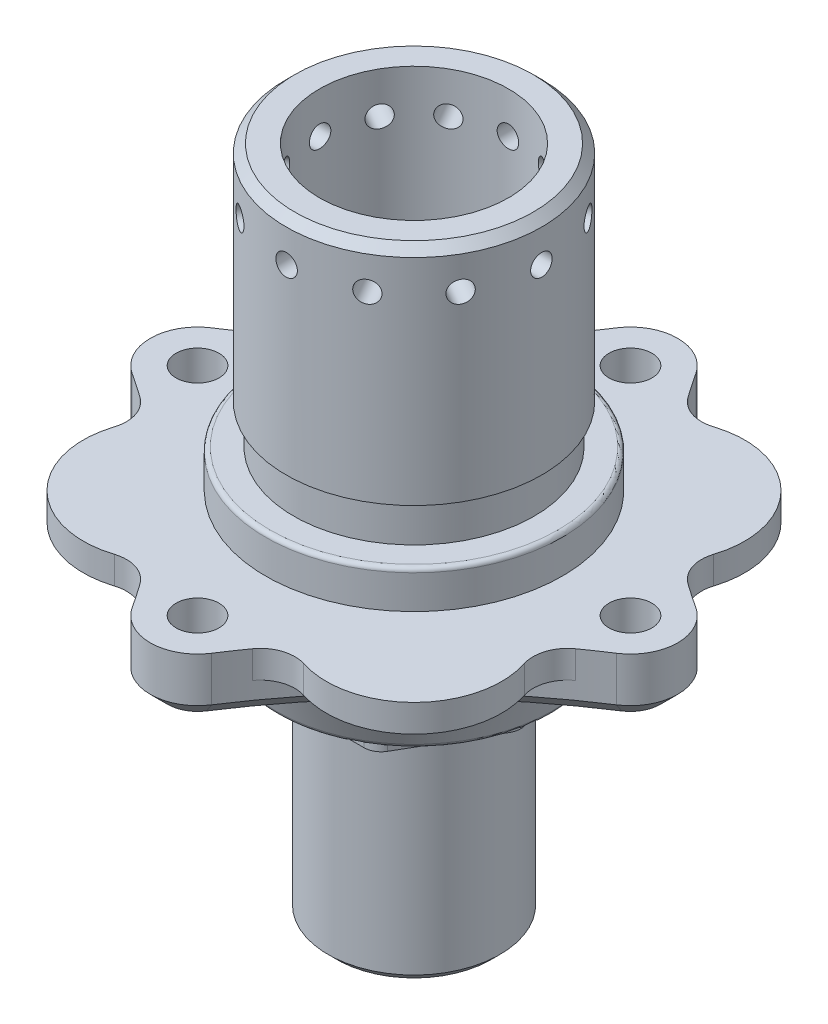
from build123d import *

# Parameters (mm, degrees)
DRIVE_PIN_HOLES_D             = 7.9375
DRIVE_PIN_HOLES_PATTERN_COUNT = 4
FLANGE_START                  = -6.35
SKETCH8_R                     = 52.3875
FLANGE_SUPPORT_CUT_DEPTH      = 6.35
SKETCH9_R                     = 52.3875
FLORAL_PATTERN_CUT_DEPTH      = 98.133120699
SKETCH10_R                    = 25.0825
BRAKE_HAT_HEX_DEPTH           = 4.7625
F_5_16_CLEARANCE_HOLE1_D      = 8.2042
BRAKE_HAT_FILLET_R            = 3.175
HUB_FILLET_R                  = 0.79375
SKETCH14_R                    = 1.984375
PIN_HOLES_DEPTH               = 97.111729302
PIN_HOLE_PATTERN_COUNT        = 12
FLORAL_PATTERN_CHAMFER_SIZE   = 3.175
FLORAL_PATTERN_FILLET_R       = 6.35
FLANGE_FILLET_R               = 1.27
CUT_EXTRUDE1_DEPTH            = 12.954
FILLET1_R                     = 3.175


with BuildPart() as part:
    # Sketch1 → Bearing Shaft/Flange Support (revolve)
    with BuildSketch(Plane(origin=(0, 0, 0), x_dir=(0, 0, -1), z_dir=(1, 0, 0))):
        Polygon((0, 0), (-29.479347783, 0), (-25.0825, -12.08024), (-25.0825, -16.84274), (-15.8877, -16.84274), (-15.8877, -54.87924), (-14.3002, -56.46674), (0, -56.46674), align=None)
    revolve(axis=Axis((0, 0, 0), (0, 1, 0)))

    # Sketch2 → Drive Pin Support (revolve)
    with BuildSketch(Plane(origin=(0, 0, 0), x_dir=(0, 0, -1), z_dir=(1, 0, 0))):
        Polygon((0, 0), (-52.3875, 0), (-52.3875, 11.43), (-27.4096, 11.43), (-27.4096, 18.43), (-22.225, 18.43), (-22.225, 25.7175), (-23.61946, 25.7175), (-23.61946, 65.405), (-22.03196, 66.9925), (0, 66.9925), align=None)
    revolve(axis=Axis((0, 0, 0), (0, 1, 0)))

    # Sketch5 → Center Mass Removal (revolve, cut)
    with BuildSketch(Plane(origin=(0, 0, 0), x_dir=(0, 0, -1), z_dir=(1, 0, 0))):
        Polygon((0, 66.9925), (17.4625, 66.9925), (17.4625, 19.3675), (12.7, -12.3825), (0, -12.3825), align=None)
    revolve(axis=Axis((0, 0, 0), (0, -1, 0)), mode=Mode.SUBTRACT)

    # Drive Pin Holes (through all)
    with Locations(Plane(origin=(0, 0, 0), x_dir=(-1, 0, 0), z_dir=(0, -1, 0))):
        with Locations((0, -40)):
            drive_pin_holes = Hole(DRIVE_PIN_HOLES_D / 2)

    # Drive Pin Holes Pattern: Drive Pin Holes ×4 about axis
    drive_pin_holes_pattern_axis = Axis((0, 0, 0), (0, -1, 0))
    for i in range(1, DRIVE_PIN_HOLES_PATTERN_COUNT):
        add(drive_pin_holes.rotate(drive_pin_holes_pattern_axis, i * 360 / DRIVE_PIN_HOLES_PATTERN_COUNT), mode=Mode.SUBTRACT)

    # Sketch8 → Flange Support Cut (cut)
    with BuildSketch(Plane.XZ.offset(FLANGE_START)):
        Circle(SKETCH8_R)
        with BuildLine():
            ThreePointArc((-7.324939653, 44.751840238), (0, 48.73125), (7.324939653, 44.751840238))
            ThreePointArc((7.324939653, 44.751840238), (24.066955211, 24.066955211), (44.751840238, 7.324939653))
            ThreePointArc((44.751840238, 7.324939653), (48.73125, 0), (44.751840238, -7.324939653))
            ThreePointArc((44.751840238, -7.324939653), (24.066955211, -24.066955211), (7.324939653, -44.751840238))
            ThreePointArc((7.324939653, -44.751840238), (0, -48.73125), (-7.324939653, -44.751840238))
            ThreePointArc((-7.324939653, -44.751840238), (-24.066955211, -24.066955211), (-44.751840238, -7.324939653))
            ThreePointArc((-44.751840238, -7.324939653), (-48.73125, 0), (-44.751840238, 7.324939653))
            ThreePointArc((-44.751840238, 7.324939653), (-24.066955211, 24.066955211), (-7.324939653, 44.751840238))
        make_face(mode=Mode.SUBTRACT)
    extrude(amount=FLANGE_SUPPORT_CUT_DEPTH, mode=Mode.SUBTRACT)

    # Sketch9 → Floral Pattern Cut (cut, through all)
    with BuildSketch(Plane.XZ.offset(-6.35)):
        Circle(SKETCH9_R)
        with BuildLine():
            ThreePointArc((-44.751840238, -7.324939653), (-48.73125, 0), (-44.751840238, 7.324939653))
            ThreePointArc((-44.751840238, 7.324939653), (-40.308436767, 10.342864974), (-35.996620051, 13.545979748))
            ThreePointArc((-35.996620051, 13.545979748), (-33.913330801, 33.913330801), (-13.545979748, 35.996620051))
            ThreePointArc((-13.545979748, 35.996620051), (-10.342864974, 40.308436767), (-7.324939653, 44.751840238))
            ThreePointArc((-7.324939653, 44.751840238), (0, 48.73125), (7.324939653, 44.751840238))
            ThreePointArc((7.324939653, 44.751840238), (10.342864974, 40.308436767), (13.545979748, 35.996620051))
            ThreePointArc((13.545979748, 35.996620051), (33.913330801, 33.913330801), (35.996620051, 13.545979748))
            ThreePointArc((35.996620051, 13.545979748), (40.308436767, 10.342864974), (44.751840238, 7.324939653))
            ThreePointArc((44.751840238, 7.324939653), (48.73125, 0), (44.751840238, -7.324939653))
            ThreePointArc((44.751840238, -7.324939653), (40.308436767, -10.342864974), (35.996620051, -13.545979748))
            ThreePointArc((35.996620051, -13.545979748), (33.913330801, -33.913330801), (13.545979748, -35.996620051))
            ThreePointArc((13.545979748, -35.996620051), (10.342864974, -40.308436767), (7.324939653, -44.751840238))
            ThreePointArc((7.324939653, -44.751840238), (0, -48.73125), (-7.324939653, -44.751840238))
            ThreePointArc((-7.324939653, -44.751840238), (-10.342864974, -40.308436767), (-13.545979748, -35.996620051))
            ThreePointArc((-13.545979748, -35.996620051), (-33.913330801, -33.913330801), (-35.996620051, -13.545979748))
            ThreePointArc((-35.996620051, -13.545979748), (-40.308436767, -10.342864974), (-44.751840238, -7.324939653))
        make_face(mode=Mode.SUBTRACT)
    extrude(amount=-FLORAL_PATTERN_CUT_DEPTH, mode=Mode.SUBTRACT)

    # Sketch10 → Brake Hat Hex (cut)
    with BuildSketch(Plane.XZ.offset(16.84274)):
        Circle(SKETCH10_R)
        Polygon((10.102509651, -17.49806), (20.205019303, 0), (10.102509651, 17.49806), (-10.102509651, 17.49806), (-20.205019303, 0), (-10.102509651, -17.49806), align=None, mode=Mode.SUBTRACT)
    extrude(amount=-BRAKE_HAT_HEX_DEPTH, mode=Mode.SUBTRACT)

    # 5/16 Clearance Hole1 (through all)
    with Locations(Plane(origin=(0, -56.46674, 0), x_dir=(-1, 0, 0), z_dir=(0, -1, 0))):
        with Locations((0, 0)):
            Hole(F_5_16_CLEARANCE_HOLE1_D / 2)

    # Brake Hat Fillet
    brake_hat_fillet_edges = [part.edges().sort_by_distance(p)[0] for p in [
        (20.205019303, -14.46149, 0),
        (10.102509651, -14.46149, 17.49806),
        (-10.102509651, -14.46149, 17.49806),
        (-20.205019303, -14.46149, 0),
        (-10.102509651, -14.46149, -17.49806),
        (10.102509651, -14.46149, -17.49806),
    ]]
    fillet(brake_hat_fillet_edges, radius=BRAKE_HAT_FILLET_R)

    # Hub Fillet
    hub_fillet_edges = [part.edges().sort_by_distance(p)[0] for p in [
        (0, 18.43, -27.4096),
    ]]
    fillet(hub_fillet_edges, radius=HUB_FILLET_R)

    # Sketch14 → Pin Holes (cut, through all)
    with BuildSketch(Plane(origin=(0, 0, 0), x_dir=(0, 0, -1), z_dir=(1, 0, 0))):
        with Locations((0, 59.3725)):
            Circle(SKETCH14_R)
    pin_holes = extrude(amount=-PIN_HOLES_DEPTH, mode=Mode.SUBTRACT)

    # Pin Hole Pattern: Pin Holes ×12 about axis
    pin_hole_pattern_axis = Axis((0, 66.9925, 0), (0, 1, 0))
    for i in range(1, PIN_HOLE_PATTERN_COUNT):
        add(pin_holes.rotate(pin_hole_pattern_axis, i * 360 / PIN_HOLE_PATTERN_COUNT), mode=Mode.SUBTRACT)

    # Floral Pattern Chamfer
    floral_pattern_chamfer_edges = [part.edges().sort_by_distance(p)[0] for p in [
        (0, 0, -48.73125),
        (24.066955211, 0, -24.066955211),
        (48.73125, 0, 0),
        (-24.066955211, 0, -24.066955211),
        (-48.73125, 0, 0),
        (-24.066955211, 0, 24.066955211),
        (0, 0, 48.73125),
        (24.066955211, 0, 24.066955211),
    ]]
    chamfer(floral_pattern_chamfer_edges, length=FLORAL_PATTERN_CHAMFER_SIZE)

    # Floral Pattern Fillet
    floral_pattern_fillet_edges = [part.edges().sort_by_distance(p)[0] for p in [
        (-35.996620051, 8.89, 13.545979748),
        (-35.996620051, 8.89, -13.545979748),
        (-13.545979748, 8.89, -35.996620051),
        (13.545979748, 8.89, -35.996620051),
        (35.996620051, 8.89, -13.545979748),
        (35.996620051, 8.89, 13.545979748),
        (-13.545979748, 8.89, 35.996620051),
        (13.545979748, 8.89, 35.996620051),
    ]]
    fillet(floral_pattern_fillet_edges, radius=FLORAL_PATTERN_FILLET_R)

    # Flange Fillet
    flange_fillet_edges = [part.edges().sort_by_distance(p)[0] for p in [
        (0, -12.08024, -25.0825),
    ]]
    fillet(flange_fillet_edges, radius=FLANGE_FILLET_R)

    # Sketch17 → Cut-Extrude1 (cut)
    with BuildSketch(Plane.XZ.offset(56.46674)):
        Polygon((5.499261314, 9.525), (-5.499261314, 9.525), (-10.998522628, 0), (-5.499261314, -9.525), (5.499261314, -9.525), (10.998522628, 0), align=None)
    extrude(amount=-CUT_EXTRUDE1_DEPTH, mode=Mode.SUBTRACT)

    # Fillet1
    fillet1_edges = [part.edges().sort_by_distance(p)[0] for p in [
        (-5.499261314, -49.98974, -9.525),
        (5.499261314, -49.98974, -9.525),
        (10.998522628, -49.98974, 0),
        (5.499261314, -49.98974, 9.525),
        (-5.499261314, -49.98974, 9.525),
        (-10.998522628, -49.98974, 0),
    ]]
    fillet(fillet1_edges, radius=FILLET1_R)


solid = part.part
